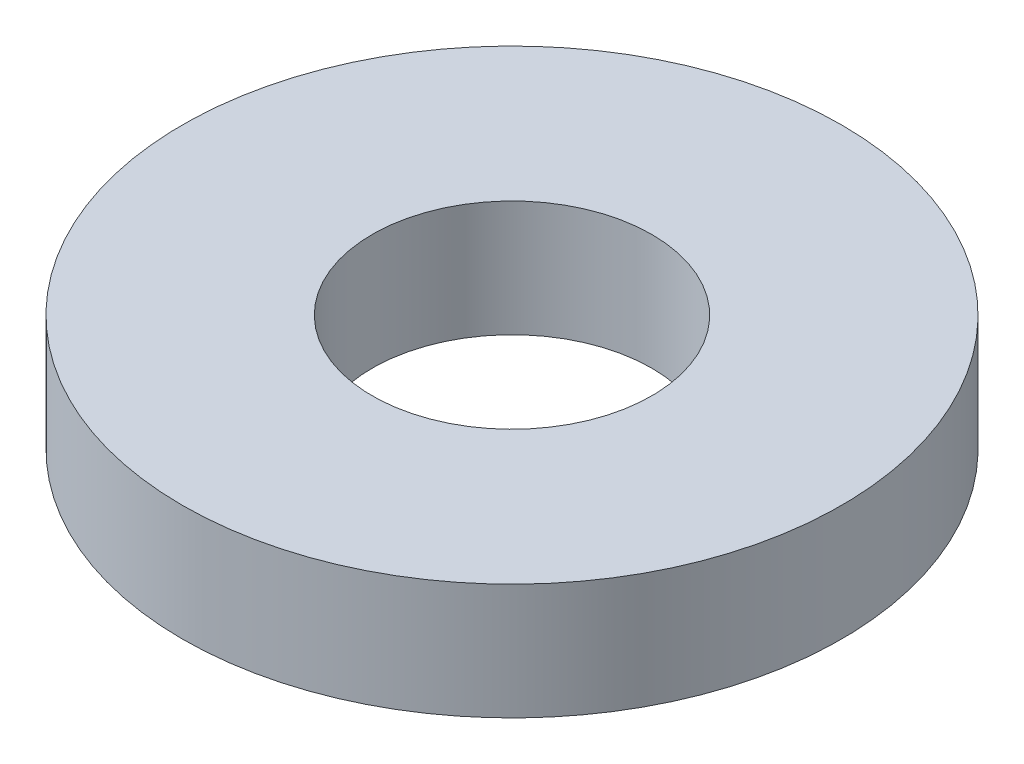
from build123d import *

# Parameters (mm, degrees)
SKETCH1_R           = 82.5
BOSS_EXTRUDE1_DEPTH = 29
SKETCH2_R           = 35
CUT_EXTRUDE1_DEPTH  = 121.222710001


with BuildPart() as part:
    # Sketch1 → Boss-Extrude1 (new body)
    with BuildSketch(Plane(origin=(0, 0, 0), x_dir=(1, 0, 0), z_dir=(0, 1, 0))):
        Circle(SKETCH1_R)
    extrude(amount=BOSS_EXTRUDE1_DEPTH)

    # Sketch2 → Cut-Extrude1 (cut, through all)
    with BuildSketch(Plane(origin=(0, 0, 0), x_dir=(1, 0, 0), z_dir=(0, 1, 0))):
        Circle(SKETCH2_R)
    extrude(amount=CUT_EXTRUDE1_DEPTH, mode=Mode.SUBTRACT)


solid = part.part
